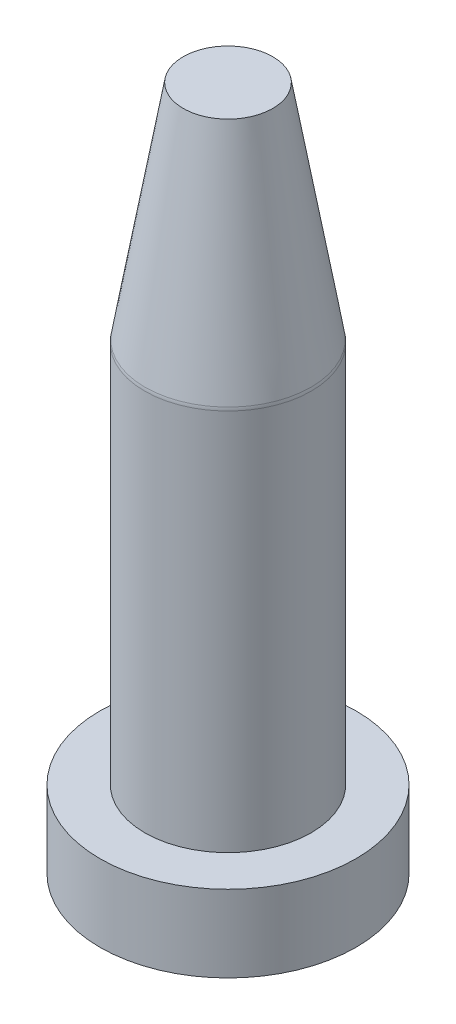
from build123d import *

# Parameters (mm, degrees)
FILLET_1_R = 3


with BuildPart() as part:
    # 草图1 → Revolve 295 (revolve)
    with BuildSketch(Plane.XY):
        Polygon((0, 0), (20, 0), (20, 12), (13, 12), (13, 72), (7, 107), (0, 107), align=None)
    revolve(axis=Axis((0, 0, 0), (0, 1, 0)))

    # 圆角1
    fillet_1_edges = [part.edges().sort_by_distance(p)[0] for p in [
        (-13, 72, 0),
    ]]
    fillet(fillet_1_edges, radius=FILLET_1_R)


solid = part.part
